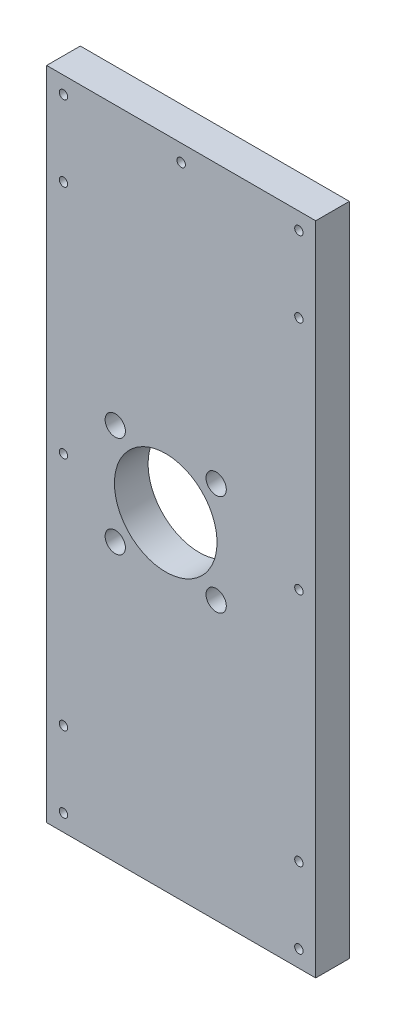
from build123d import *

# Parameters (mm, degrees)
SKIZZE1_W                       = 80
SKIZZE1_H                       = 195
AUFSATZ_LINEAR_AUSTRAGEN1_DEPTH = 10
SKIZZE2_R                       = 3.015
SKIZZE2_R_2                     = 15.25
SCHNITT_LINEAR_AUSTRAGEN1_DEPTH = 10
SKIZZE3_R                       = 2.5
SCHNITT_LINEAR_AUSTRAGEN2_DEPTH = 5
SKIZZE6_R                       = 1.25
SCHNITT_LINEAR_AUSTRAGEN4_DEPTH = 5


with BuildPart() as part:
    # Skizze1 → Aufsatz-Linear austragen1 (new body)
    with BuildSketch(Plane.XY):
        with Locations((-29.059385344, -27.400468384)):
            Rectangle(SKIZZE1_W, SKIZZE1_H)
    extrude(amount=-AUFSATZ_LINEAR_AUSTRAGEN1_DEPTH)

    # Skizze2 → Schnitt-Linear austragen1 (cut)
    with BuildSketch(Plane(origin=(0, 0, -10), x_dir=(-1, 0, 0), z_dir=(0, 0, -1))):
        with Locations((18.659385344, -12.400468384)):
            Circle(SKIZZE2_R)
        with Locations((48.659385344, -12.400468384)):
            Circle(SKIZZE2_R)
        with Locations((18.659385344, -42.400468384)):
            Circle(SKIZZE2_R)
        with Locations((48.659385344, -42.400468384)):
            Circle(SKIZZE2_R)
        with Locations((33.659385344, -27.400468384)):
            Circle(SKIZZE2_R_2)
    extrude(amount=-SCHNITT_LINEAR_AUSTRAGEN1_DEPTH, mode=Mode.SUBTRACT)

    # Skizze3 → Schnitt-Linear austragen2 (cut)
    with BuildSketch(Plane(origin=(0, 0, -10), x_dir=(-1, 0, 0), z_dir=(0, 0, -1))):
        with Locations((29.059385344, 65.099531616)):
            Circle(SKIZZE3_R)
        with Locations((-5.940614656, 65.099531616)):
            Circle(SKIZZE3_R)
        with Locations((64.059385344, 65.099531616)):
            Circle(SKIZZE3_R)
        with Locations((29.059385344, -119.900468384)):
            Circle(SKIZZE3_R)
        with Locations((-5.940614656, -119.900468384)):
            Circle(SKIZZE3_R)
        with Locations((64.059385344, -119.900468384)):
            Circle(SKIZZE3_R)
        with Locations((-5.940614656, 42.599531616)):
            Circle(SKIZZE3_R)
        with Locations((-5.940614656, -27.400468384)):
            Circle(SKIZZE3_R)
        with Locations((-5.940614656, -97.400468384)):
            Circle(SKIZZE3_R)
        with Locations((64.059385344, -97.400468384)):
            Circle(SKIZZE3_R)
        with Locations((64.059385344, -27.400468384)):
            Circle(SKIZZE3_R)
        with Locations((64.059385344, 42.599531616)):
            Circle(SKIZZE3_R)
    extrude(amount=-SCHNITT_LINEAR_AUSTRAGEN2_DEPTH, mode=Mode.SUBTRACT)

    # Skizze6 → Schnitt-Linear austragen4 (cut)
    with BuildSketch(Plane.XY):
        with Locations((-64.059385344, 65.099531616)):
            Circle(SKIZZE6_R)
        with Locations((-29.059385344, 65.099531616)):
            Circle(SKIZZE6_R)
        with Locations((5.940614656, 65.099531616)):
            Circle(SKIZZE6_R)
        with Locations((-64.059385344, 42.599531616)):
            Circle(SKIZZE6_R)
        with Locations((-64.059385344, -27.400468384)):
            Circle(SKIZZE6_R)
        with Locations((-64.059385344, -97.400468384)):
            Circle(SKIZZE6_R)
        with Locations((-64.059385344, -119.900468384)):
            Circle(SKIZZE6_R)
        with Locations((5.940614656, -119.900468384)):
            Circle(SKIZZE6_R)
        with Locations((5.940614656, -97.400468384)):
            Circle(SKIZZE6_R)
        with Locations((5.940614656, -27.400468384)):
            Circle(SKIZZE6_R)
        with Locations((5.940614656, 42.599531616)):
            Circle(SKIZZE6_R)
    extrude(amount=-SCHNITT_LINEAR_AUSTRAGEN4_DEPTH, mode=Mode.SUBTRACT)


solid = part.part
